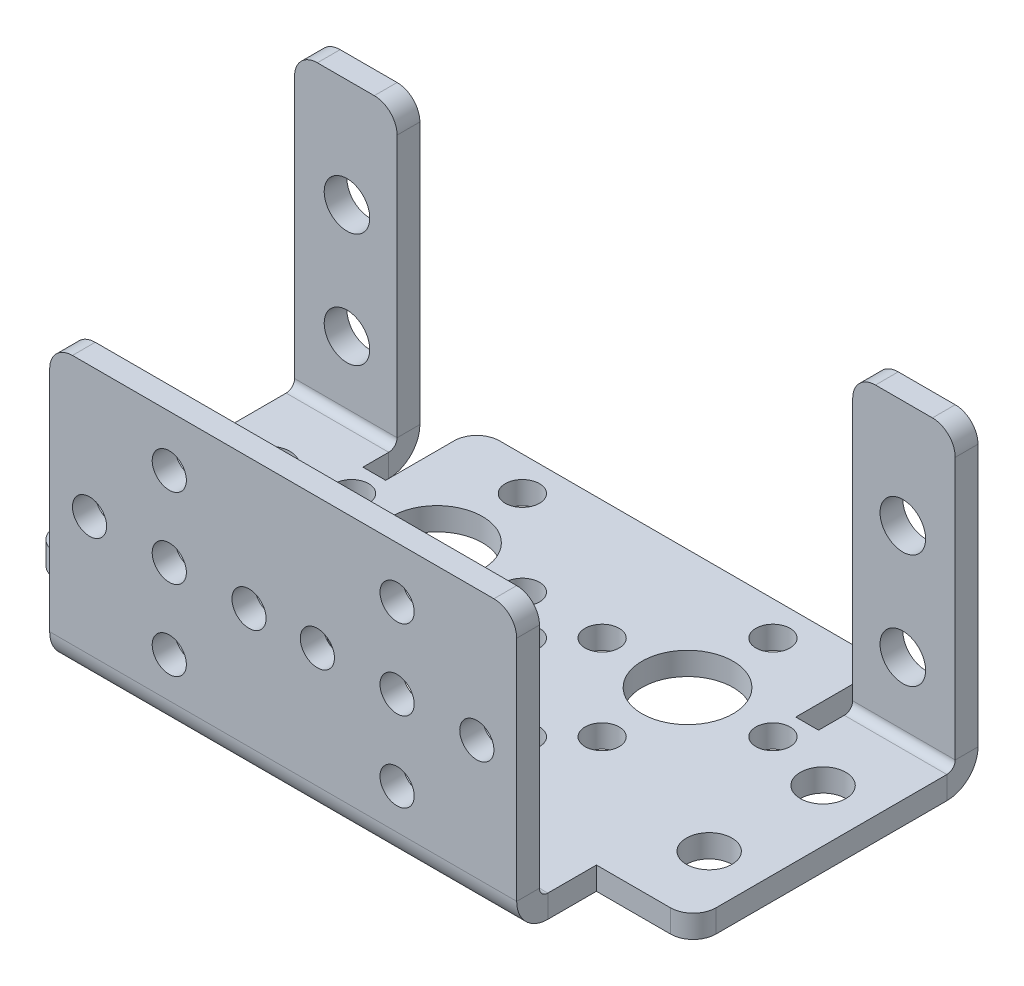
from build123d import *

# Parameters (mm, degrees)
SKETCH1_R                    = 1.5
SKETCH1_R_2                  = 2
SKETCH1_R_3                  = 4
BASE_FLANGE1_DEPTH           = 2
SKETCHED_START               = -20.5
SKETCHED_BEND1_DEPTH         = 41
SKETCHED_START_2             = -29
SKETCHED_BEND1_2_DEPTH       = 9
SKETCHED_START_3             = 20
SKETCHED_BEND1_3_DEPTH       = 9
SKETCHED_BEND1_4_DEPTH       = 41
SKETCHED_BEND1_5_DEPTH       = 9
SKETCHED_BEND1_6_DEPTH       = 9
SKETCHED_START_4             = -26
SKETCHED_BEND1_7_OUTLINE_R   = 1.5
SKETCHED_BEND1_7_OUTLINE_R_2 = 2
SKETCHED_BEND1_7_DEPTH       = 33
SKETCHED_START_5             = 5
SKETCHED_BEND1_8_DEPTH       = 2


with BuildPart() as part:
    # Base-Flange1: sheet metal written as solids
    # Sketch1 → Base-Flange1 (new body)
    with BuildSketch(Plane(origin=(0, 0, 0), x_dir=(1, 0, 0), z_dir=(0, 1, 0))):
        with BuildLine():
            Line((-27, 0), (-20.5, 0))
            Line((-20.5, 0), (-20.5, -27))
            ThreePointArc((-20.5, -27), (-19.914213562, -28.414213562), (-18.5, -29))
            Line((-18.5, -29), (18.5, -29))
            ThreePointArc((18.5, -29), (19.914213562, -28.414213562), (20.5, -27))
            Line((20.5, -27), (20.5, 0))
            Line((20.5, 0), (27, 0))
            ThreePointArc((27, 0), (28.414213562, 0.585786438), (29, 2))
            Line((29, 2), (29, 48))
            ThreePointArc((29, 48), (28.414213562, 49.414213562), (27, 50))
            Line((27, 50), (22, 50))
            ThreePointArc((22, 50), (20.585786438, 49.414213562), (20, 48))
            Line((20, 48), (20, 20))
            Line((20, 20), (18, 20))
            Line((18, 20), (18, 26))
            ThreePointArc((18, 26), (17.414213562, 27.414213562), (16, 28))
            Line((16, 28), (-16, 28))
            ThreePointArc((-16, 28), (-17.414213562, 27.414213562), (-18, 26))
            Line((-18, 26), (-18, 20))
            Line((-18, 20), (-20, 20))
            Line((-20, 20), (-20, 48))
            ThreePointArc((-20, 48), (-20.585786438, 49.414213562), (-22, 50))
            Line((-22, 50), (-27, 50))
            ThreePointArc((-27, 50), (-28.414213562, 49.414213562), (-29, 48))
            Line((-29, 48), (-29, 2))
            ThreePointArc((-29, 2), (-28.414213562, 0.585786438), (-27, 0))
        make_face()
        with Locations(Location((-17, -17.5, 0), (0, 0, 270))):
            Circle(SKETCH1_R, mode=Mode.SUBTRACT)
        with Locations(Location((-10, -17.5, 0), (0, 0, 270))):
            Circle(SKETCH1_R, mode=Mode.SUBTRACT)
        with Locations(Location((-10, -10.5, 0), (0, 0, 270))):
            Circle(SKETCH1_R, mode=Mode.SUBTRACT)
        with Locations(Location((-3, -17.5, 0), (0, 0, 270))):
            Circle(SKETCH1_R, mode=Mode.SUBTRACT)
        with Locations(Location((-10, -24.5, 0), (0, 0, 270))):
            Circle(SKETCH1_R, mode=Mode.SUBTRACT)
        with Locations(Location((24.4, 40.5, 0), (0, 0, 270))):
            Circle(SKETCH1_R_2, mode=Mode.SUBTRACT)
        with Locations(Location((24.4, 30.5, 0), (0, 0, 270))):
            Circle(SKETCH1_R_2, mode=Mode.SUBTRACT)
        with Locations(Location((-24.4, 30.5, 0), (0, 0, 90))):
            Circle(SKETCH1_R_2, mode=Mode.SUBTRACT)
        with Locations(Location((-24.4, 40.5, 0), (0, 0, 90))):
            Circle(SKETCH1_R_2, mode=Mode.SUBTRACT)
        with Locations(Location((24.4, 6, 0), (0, 0, 270))):
            Circle(SKETCH1_R_2, mode=Mode.SUBTRACT)
        with Locations(Location((24.4, 16, 0), (0, 0, 270))):
            Circle(SKETCH1_R_2, mode=Mode.SUBTRACT)
        with Locations(Location((-24.4, 16, 0), (0, 0, 90))):
            Circle(SKETCH1_R_2, mode=Mode.SUBTRACT)
        with Locations(Location((-24.4, 6, 0), (0, 0, 90))):
            Circle(SKETCH1_R_2, mode=Mode.SUBTRACT)
        with Locations(Location((0, -1, 0), (0, 0, 270))):
            Circle(SKETCH1_R, mode=Mode.SUBTRACT)
        with Locations(Location((0, 6.5, 0), (0, 0, 270))):
            Circle(SKETCH1_R_3, mode=Mode.SUBTRACT)
        with Locations(Location((-7.5, 6.5, 0), (0, 0, 270))):
            Circle(SKETCH1_R, mode=Mode.SUBTRACT)
        with Locations(Location((0, 14, 0), (0, 0, 270))):
            Circle(SKETCH1_R, mode=Mode.SUBTRACT)
        with Locations(Location((7.5, 6.5, 0), (0, 0, 270))):
            Circle(SKETCH1_R, mode=Mode.SUBTRACT)
        with Locations(Location((-3.5, 17.5, 0), (0, 0, 270))):
            Circle(SKETCH1_R, mode=Mode.SUBTRACT)
        with Locations(Location((-11, 17.5, 0), (0, 0, 270))):
            Circle(SKETCH1_R_3, mode=Mode.SUBTRACT)
        with Locations(Location((-11, 25, 0), (0, 0, 270))):
            Circle(SKETCH1_R, mode=Mode.SUBTRACT)
        with Locations(Location((-18.5, 17.5, 0), (0, 0, 270))):
            Circle(SKETCH1_R, mode=Mode.SUBTRACT)
        with Locations(Location((-11, 10, 0), (0, 0, 270))):
            Circle(SKETCH1_R, mode=Mode.SUBTRACT)
        with Locations(Location((3.5, 17.5, 0), (0, 0, 270))):
            Circle(SKETCH1_R, mode=Mode.SUBTRACT)
        with Locations(Location((11, 17.5, 0), (0, 0, 270))):
            Circle(SKETCH1_R_3, mode=Mode.SUBTRACT)
        with Locations(Location((11, 10, 0), (0, 0, 270))):
            Circle(SKETCH1_R, mode=Mode.SUBTRACT)
        with Locations(Location((18.5, 17.5, 0), (0, 0, 270))):
            Circle(SKETCH1_R, mode=Mode.SUBTRACT)
        with Locations(Location((11, 25, 0), (0, 0, 270))):
            Circle(SKETCH1_R, mode=Mode.SUBTRACT)
        with Locations(Location((10, -10.5, 0), (0, 0, 90))):
            Circle(SKETCH1_R, mode=Mode.SUBTRACT)
        with Locations(Location((10, -24.5, 0), (0, 0, 90))):
            Circle(SKETCH1_R, mode=Mode.SUBTRACT)
        with Locations(Location((3, -17.5, 0), (0, 0, 90))):
            Circle(SKETCH1_R, mode=Mode.SUBTRACT)
        with Locations(Location((10, -17.5, 0), (0, 0, 90))):
            Circle(SKETCH1_R, mode=Mode.SUBTRACT)
        with Locations(Location((17, -17.5, 0), (0, 0, 90))):
            Circle(SKETCH1_R, mode=Mode.SUBTRACT)
    extrude(amount=-BASE_FLANGE1_DEPTH)

    # Sketched Bend1: read off the stored shape, not the designer's step
    # Sketched Bend1 outline → Sketched Bend1 (cut)
    with BuildSketch(Plane.YZ.offset(SKETCHED_START)):
        with BuildLine():
            Line((-2, 29), (-2, 4.2634))
            ThreePointArc((-2, 4.2634), (-1.443395312, 5.917667209), (0, 6.899002398))
            Line((0, 6.899002398), (0, 29))
            Line((0, 29), (-2, 29))
        make_face()
    extrude(amount=SKETCHED_BEND1_DEPTH, mode=Mode.SUBTRACT)

    # Sketched Bend1 2 outline → Sketched Bend1 2 (cut)
    with BuildSketch(Plane.YZ.offset(SKETCHED_START_2)):
        with BuildLine():
            ThreePointArc((0, -24.899002398), (-1.443395312, -23.917667209), (-2, -22.2634))
            Line((-2, -22.2634), (-2, -50))
            Line((-2, -50), (0, -50))
            Line((0, -50), (0, -24.899002398))
        make_face()
    extrude(amount=SKETCHED_BEND1_2_DEPTH, mode=Mode.SUBTRACT)

    # Sketched Bend1 3 outline → Sketched Bend1 3 (cut)
    with BuildSketch(Plane.YZ.offset(SKETCHED_START_3)):
        with BuildLine():
            ThreePointArc((0, -24.899002398), (-1.443395312, -23.917667209), (-2, -22.2634))
            Line((-2, -22.2634), (-2, -50))
            Line((-2, -50), (0, -50))
            Line((0, -50), (0, -24.899002398))
        make_face()
    extrude(amount=SKETCHED_BEND1_3_DEPTH, mode=Mode.SUBTRACT)

    # Sketched Bend1 4 outline → Sketched Bend1 4 (add)
    with BuildSketch(Plane.YZ.offset(SKETCHED_START)):
        with BuildLine():
            ThreePointArc((0.7366, 7), (0.364854094, 6.974633029), (0, 6.899002398))
            Line((0, 6.899002398), (0, 4.2634))
            ThreePointArc((0, 4.2634), (0.215745145, 4.784254855), (0.7366, 5))
            Line((0.7366, 5), (22.745355099, 5))
            Line((22.745355099, 5), (22.745355099, 7))
            Line((22.745355099, 7), (0.7366, 7))
        make_face()
    extrude(amount=SKETCHED_BEND1_4_DEPTH)

    # Sketched Bend1 5 outline → Sketched Bend1 5 (add)
    with BuildSketch(Plane.YZ.offset(SKETCHED_START_2)):
        with BuildLine():
            Line((0, -22.2634), (0, -24.899002398))
            ThreePointArc((0, -24.899002398), (0.364854094, -24.974633029), (0.7366, -25))
            Line((0.7366, -25), (25.745355099, -25))
            Line((25.745355099, -25), (25.745355099, -23))
            Line((25.745355099, -23), (0.7366, -23))
            ThreePointArc((0.7366, -23), (0.215745145, -22.784254855), (0, -22.2634))
        make_face()
    extrude(amount=SKETCHED_BEND1_5_DEPTH)

    # Sketched Bend1 6 outline → Sketched Bend1 6 (add)
    with BuildSketch(Plane.YZ.offset(SKETCHED_START_3)):
        with BuildLine():
            Line((0, -22.2634), (0, -24.899002398))
            ThreePointArc((0, -24.899002398), (0.364854094, -24.974633029), (0.7366, -25))
            Line((0.7366, -25), (25.745355099, -25))
            Line((25.745355099, -25), (25.745355099, -23))
            Line((25.745355099, -23), (0.7366, -23))
            ThreePointArc((0.7366, -23), (0.215745145, -22.784254855), (0, -22.2634))
        make_face()
    extrude(amount=SKETCHED_BEND1_6_DEPTH)

    # Sketched Bend1 7 outline → Sketched Bend1 7 (cut)
    with BuildSketch(Plane.XY.offset(SKETCHED_START_4)):
        with BuildLine():
            ThreePointArc((-29, 23.745355099), (-28.414213562, 25.159568661), (-27, 25.745355099))
            Line((-27, 25.745355099), (-29, 25.745355099))
            Line((-29, 25.745355099), (-29, 23.745355099))
        make_face()
        with BuildLine():
            ThreePointArc((-22, 25.745355099), (-20.585786438, 25.159568661), (-20, 23.745355099))
            Line((-20, 23.745355099), (-20, 25.745355099))
            Line((-20, 25.745355099), (-22, 25.745355099))
        make_face()
        with BuildLine():
            Line((29, 25.745355099), (27, 25.745355099))
            ThreePointArc((27, 25.745355099), (28.414213562, 25.159568661), (29, 23.745355099))
            Line((29, 23.745355099), (29, 25.745355099))
        make_face()
        with BuildLine():
            Line((20, 25.745355099), (20, 23.745355099))
            ThreePointArc((20, 23.745355099), (20.585786438, 25.159568661), (22, 25.745355099))
            Line((22, 25.745355099), (20, 25.745355099))
        make_face()
        with BuildLine():
            Line((20, 22.745355099), (18.5, 22.745355099))
            ThreePointArc((18.5, 22.745355099), (19.322875656, 22.568230754), (20, 22.068230754))
            Line((20, 22.068230754), (20, 22.745355099))
        make_face()
        with BuildLine():
            Line((-20, 22.745355099), (-20, 22.068230754))
            ThreePointArc((-20, 22.068230754), (-19.322875656, 22.568230754), (-18.5, 22.745355099))
            Line((-18.5, 22.745355099), (-20, 22.745355099))
        make_face()
        with Locations((17, 11.245355099)):
            Circle(SKETCHED_BEND1_7_OUTLINE_R)
        with Locations((-10, 18.245355099)):
            Circle(SKETCHED_BEND1_7_OUTLINE_R)
        with Locations((-3, 11.245355099)):
            Circle(SKETCHED_BEND1_7_OUTLINE_R)
        with Locations((-10, 4.245355099)):
            Circle(SKETCHED_BEND1_7_OUTLINE_R)
        with Locations((-17, 11.245355099)):
            Circle(SKETCHED_BEND1_7_OUTLINE_R)
        with Locations((10, 11.245355099)):
            Circle(SKETCHED_BEND1_7_OUTLINE_R)
        with Locations((3, 11.245355099)):
            Circle(SKETCHED_BEND1_7_OUTLINE_R)
        with Locations((10, 18.245355099)):
            Circle(SKETCHED_BEND1_7_OUTLINE_R)
        with Locations((-10, 11.245355099)):
            Circle(SKETCHED_BEND1_7_OUTLINE_R)
        with Locations((10, 4.245355099)):
            Circle(SKETCHED_BEND1_7_OUTLINE_R)
        with Locations((24.4, 16.245355099)):
            Circle(SKETCHED_BEND1_7_OUTLINE_R_2)
        with Locations((24.4, 6.245355099)):
            Circle(SKETCHED_BEND1_7_OUTLINE_R_2)
        with Locations((-24.4, 6.245355099)):
            Circle(SKETCHED_BEND1_7_OUTLINE_R_2)
        with Locations((-24.4, 16.245355099)):
            Circle(SKETCHED_BEND1_7_OUTLINE_R_2)
    extrude(amount=SKETCHED_BEND1_7_DEPTH, mode=Mode.SUBTRACT)

    # Sketched Bend1 8 outline → Sketched Bend1 8 (cut)
    with BuildSketch(Plane.XY.offset(SKETCHED_START_5)):
        with BuildLine():
            Line((-20.5, 22.745355099), (-20.5, 20.745355099))
            ThreePointArc((-20.5, 20.745355099), (-20.370828693, 21.45246188), (-20, 22.068230754))
            Line((-20, 22.068230754), (-20, 22.745355099))
            Line((-20, 22.745355099), (-20.5, 22.745355099))
        make_face()
        with BuildLine():
            Line((20, 22.745355099), (20, 22.068230754))
            ThreePointArc((20, 22.068230754), (20.370828693, 21.45246188), (20.5, 20.745355099))
            Line((20.5, 20.745355099), (20.5, 22.745355099))
            Line((20.5, 22.745355099), (20, 22.745355099))
        make_face()
    extrude(amount=SKETCHED_BEND1_8_DEPTH, mode=Mode.SUBTRACT)


solid = part.part
